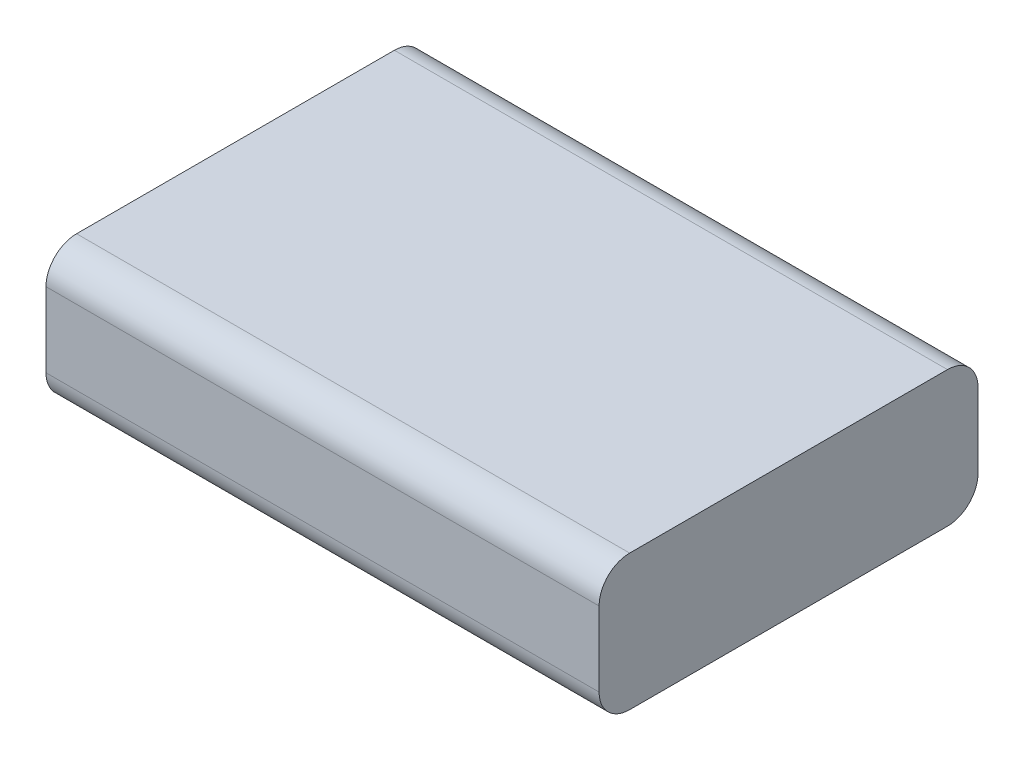
from build123d import *

# Parameters (mm, degrees)
SKETCH1_W           = 90.5
SKETCH1_H           = 62
BOSS_EXTRUDE1_DEPTH = 22.2
FILLET1_R           = 5


with BuildPart() as part:
    # Sketch1 → Boss-Extrude1 (new body)
    with BuildSketch(Plane(origin=(0, 0, 0), x_dir=(1, 0, 0), z_dir=(0, 1, 0))):
        with Locations((45.25, 31)):
            Rectangle(SKETCH1_W, SKETCH1_H)
    extrude(amount=BOSS_EXTRUDE1_DEPTH)

    # Fillet1
    fillet1_edges = [part.edges().sort_by_distance(p)[0] for p in [
        (45.25, 0, -62),
        (45.25, 22.2, -62),
        (45.25, 0, 0),
        (45.25, 22.2, 0),
    ]]
    fillet(fillet1_edges, radius=FILLET1_R)


solid = part.part
